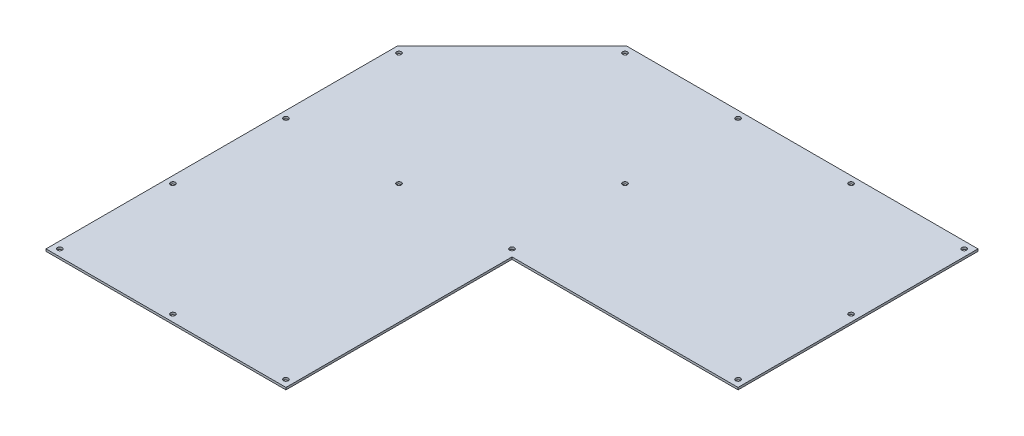
from build123d import *

# Parameters (mm, degrees)
BASE_FLANGE1_DEPTH              = 1.5875
F_29_0_136_DIAMETER_HOLE1_D     = 3.4544
F_29_0_136_DIAMETER_HOLE1_DEPTH = 6.35
F_29_0_136_DIAMETER_HOLE1_TIP   = 1.037806461


# Sheet-metal steps are written as plain solids
with BuildPart() as part:
    # Sketch1 → Base-Flange1 (new body)
    with BuildSketch(Plane(origin=(0, 0, 0), x_dir=(1, 0, 0), z_dir=(0, 1, 0))):
        Polygon((0, 0), (0, 256.54), (83.82, 340.36), (340.36, 340.36), (340.36, 165.1), (175.26, 165.1), (175.26, 0), align=None)
    extrude(amount=-BASE_FLANGE1_DEPTH)

    # #29 (0.136) Diameter Hole1
    with Locations(Plane(origin=(0, 0, 0), x_dir=(1, 0, 0), z_dir=(0, 1, 0))):
        with Locations((5.08, 5.08), (335.28, 170.18), (87.63, 5.08), (170.18, 5.08), (5.08, 87.63), (5.08, 170.18), (5.08, 252.73), (335.28, 252.73), (335.28, 335.28), (252.73, 335.28), (170.18, 335.28), (87.63, 335.28), (170.18, 170.18), (87.63, 170.18), (170.18, 252.73)):
            Hole(F_29_0_136_DIAMETER_HOLE1_D / 2, depth=F_29_0_136_DIAMETER_HOLE1_DEPTH)
            with Locations((0, 0, -(F_29_0_136_DIAMETER_HOLE1_DEPTH + F_29_0_136_DIAMETER_HOLE1_TIP / 2))):  # 118° drill point
                Cone(0, F_29_0_136_DIAMETER_HOLE1_D / 2, F_29_0_136_DIAMETER_HOLE1_TIP, mode=Mode.SUBTRACT)


solid = part.part
